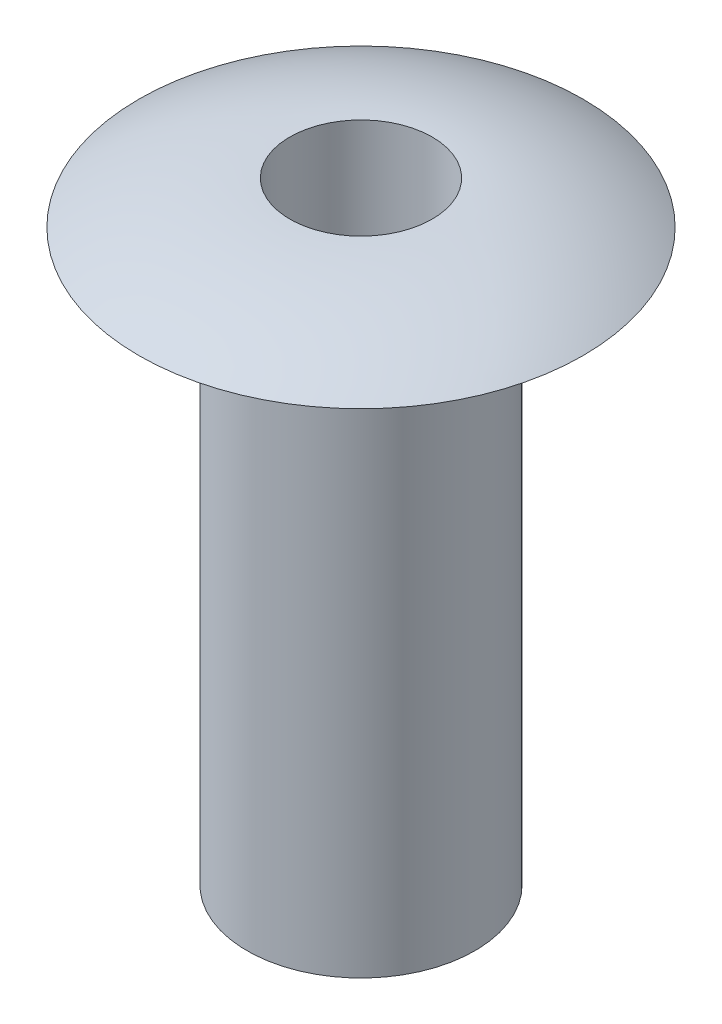
from build123d import *


with BuildPart() as part:
    # Szkic1 → Obrót1 (revolve)
    with BuildSketch(Plane.XY):
        with BuildLine():
            Line((-1.25, 10.75), (-1.25, 0))
            Line((-1.25, 0), (-2, 0))
            Line((-2, 0), (-2, 10))
            Line((-2, 10), (-3.9, 10))
            ThreePointArc((-3.9, 10), (-2.627043935, 10.558888572), (-1.25, 10.75))
        make_face()
    revolve(axis=Axis((0, 0, 0), (0, 1, 0)))


solid = part.part
